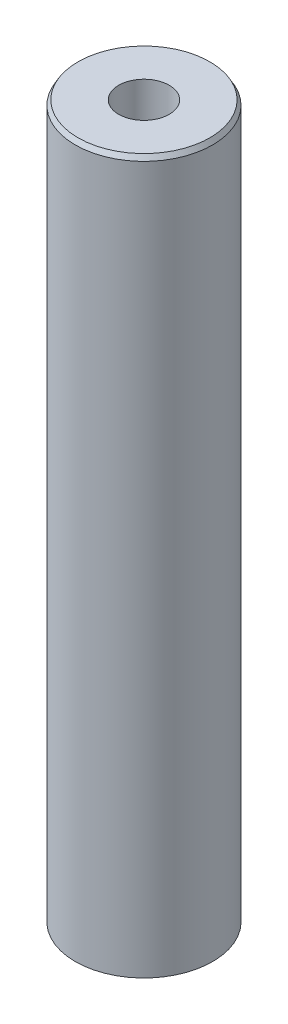
from build123d import *
from OCP.BRepFilletAPI import BRepFilletAPI_MakeChamfer

# Parameters (mm, degrees)
SKETCH1_R           = 55
BOSS_EXTRUDE1_DEPTH = 572.582427979
SKETCH2_R           = 20.227732699
CUT_EXTRUDE1_DEPTH  = 578.841359571
CHAMFER1_SIZE       = 3.844118385
CHAMFER1_SIZE2      = 2.219402784


with BuildPart() as part:
    # Sketch1 → Boss-Extrude1 (new body)
    with BuildSketch(Plane(origin=(0, 0, 0), x_dir=(1, 0, 0), z_dir=(0, 1, 0))):
        Circle(SKETCH1_R)
    extrude(amount=BOSS_EXTRUDE1_DEPTH)

    # Sketch2 → Cut-Extrude1 (cut, through all)
    with BuildSketch(Plane(origin=(0, 0, 0), x_dir=(1, 0, 0), z_dir=(0, 1, 0))):
        Circle(SKETCH2_R)
    extrude(amount=CUT_EXTRUDE1_DEPTH, mode=Mode.SUBTRACT)

    # Chamfer1: one chamfer whose edges measure the first distance from different faces: ONE call of the kernel's chamfer builder (chamfer() names one face for all edges)
    chamfer1_edges_1 = [part.edges().sort_by_distance(p)[0] for p in [
        (-55, 572.582427979, 0),
    ]]
    chamfer1_side_1 = [part.faces().sort_by_distance(p)[0] for p in [
        (-55, 286.29121399, 0),
    ]]
    chamfer1_edges_2 = [part.edges().sort_by_distance(p)[0] for p in [
        (-55, 0, 0),
    ]]
    chamfer1_side_2 = [part.faces().sort_by_distance(p)[0] for p in [
        (-53.444365081, 0, 0),
    ]]
    chamfer1 = BRepFilletAPI_MakeChamfer(part.part.solid().wrapped)
    for e in chamfer1_edges_1:
        chamfer1.Add(CHAMFER1_SIZE, CHAMFER1_SIZE2, e.wrapped, chamfer1_side_1[0].wrapped)  # the first distance lies on this face
    for e in chamfer1_edges_2:
        chamfer1.Add(CHAMFER1_SIZE, CHAMFER1_SIZE2, e.wrapped, chamfer1_side_2[0].wrapped)  # the first distance lies on this face
    add(Compound.cast(chamfer1.Shape()), mode=Mode.REPLACE)


solid = part.part
